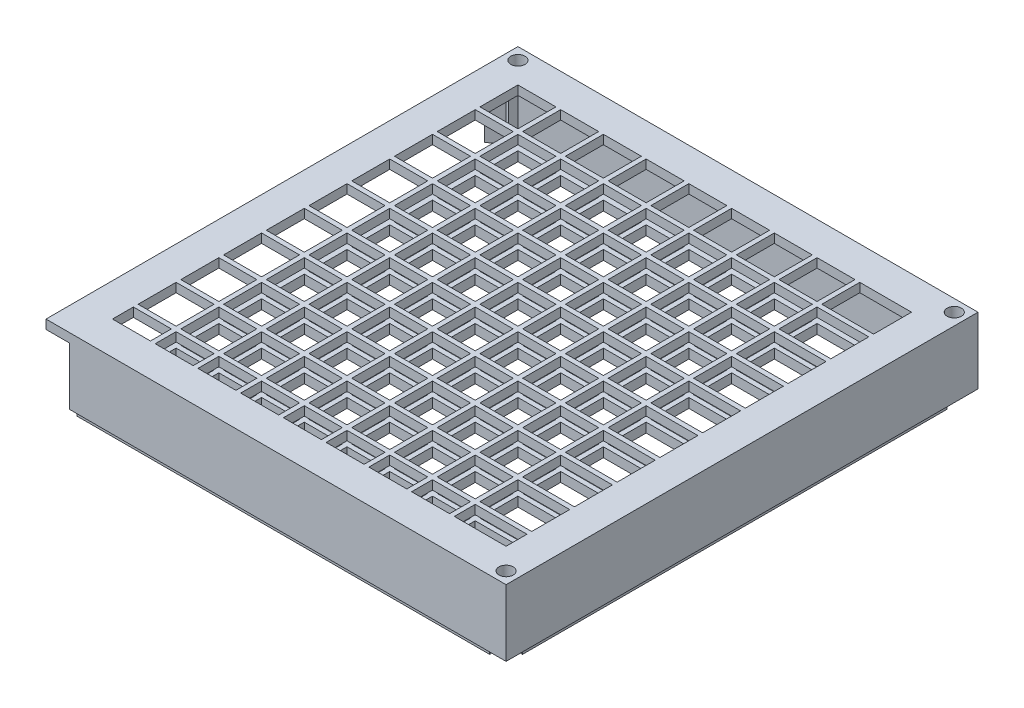
from build123d import *
from build123d.topology import SkipClean

# Parameters (mm, degrees)
EXTRUDE_1_DEPTH          = 2
EXTRUDE_2_OUTLINE_W      = 96.9
EXTRUDE_2_OUTLINE_H      = 99.4
EXTRUDE_2_OUTLINE_W_2    = 86.9
EXTRUDE_2_OUTLINE_H_2    = 89.4
EXTRUDE_2_DEPTH          = 14
CUT_EXTRUDE_1_DEPTH      = 140.334023124
CUT_EXTRUDE_1_DEPTH_BACK = 2
SKETCH_3_W               = 8
SKETCH_3_H               = 8
SKETCH_3_W_2             = 10.9
CUT_EXTRUDE_2_DEPTH      = 140.334023124
CUT_EXTRUDE_2_DEPTH_BACK = 2
SKETCH_3_5_W             = 8
SKETCH_3_5_H             = 8
SKETCH_3_5_W_2           = 10.9
CUT_EXTRUDE_3_DEPTH      = 140.334023124
CUT_EXTRUDE_3_DEPTH_BACK = 2
SKETCH_3_6_W             = 8
SKETCH_3_6_H             = 8
SKETCH_3_6_W_2           = 10.9
SKETCH_3_6_H_2           = 13.4
SKETCH_7_W               = 86.9
SKETCH_7_H               = 1.9
SKETCH_7_W_2             = 1.9
SKETCH_7_H_2             = 89.4
EXTRUDE_4_DEPTH          = 2
SKETCH_2_9_W             = 1
SKETCH_2_9_H             = 1
CUT_EXTRUDE_4_DEPTH      = 14
CUT_EXTRUDE_5_DEPTH      = 140.735357015
CUT_EXTRUDE_5_DEPTH_BACK = 14
SKETCH_9_W               = 86.9
SKETCH_9_H               = 89.4
EXTRUDE_6_DEPTH          = 1.9
SKETCH_10_W              = 8
SKETCH_10_H              = 8
SKETCH_10_W_2            = 10.9
CUT_EXTRUDE_6_DEPTH      = 1.9
CUT_EXTRUDE_7_DEPTH      = 140.735357015
CUT_EXTRUDE_7_DEPTH_BACK = 1.9
SKETCH_10_3_W            = 8
SKETCH_10_3_H            = 8
SKETCH_10_3_W_2          = 10.9
SKETCH_10_4_W            = 8
SKETCH_10_4_H            = 8
SKETCH_10_4_W_2          = 10.9
CUT_EXTRUDE_8_DEPTH      = 1.9
CUT_EXTRUDE_9_DEPTH      = 140.735357015
CUT_EXTRUDE_9_DEPTH_BACK = 1.9
SKETCH_10_5_W            = 8
SKETCH_10_5_H            = 8
SKETCH_10_5_W_2          = 10.9
SKETCH_10_5_H_2          = 4.4
SKETCH_12_W              = 5
SKETCH_12_H              = 92.4
EXTRUDE_7_DEPTH          = 1.9


with BuildPart() as part:
    # 草图2 → 凸台-拉伸1 (new body)
    with BuildSketch(Plane(origin=(0, 0, 0), x_dir=(1, 0, 0), z_dir=(0, 1, 0))):
        Polygon((5, -96.9), (5, -99.4), (96.9, -99.4), (96.9, 0), (0, 0), (0, -99.4), (2.5, -99.4), (2.5, -96.9), align=None)
    extrude(amount=EXTRUDE_1_DEPTH)


with BuildPart() as body_2:
    # 凸台-拉伸2: read off the stored shape, not the designer's step
    # 凸台-拉伸2 outline → 凸台-拉伸2 (new body)
    with BuildSketch(Plane(origin=(0, 0, 0), x_dir=(1, 0, 0), z_dir=(0, 1, 0))):
        with Locations((48.45, -49.7)):
            Rectangle(EXTRUDE_2_OUTLINE_W, EXTRUDE_2_OUTLINE_H)
        with BuildLine():
            Line((95.4, -98.018033989), (95.4, -97.9))
            Line((95.4, -97.9), (95.518033989, -97.9))
            ThreePointArc((95.518033989, -97.9), (95.460660172, -97.960660172), (95.4, -98.018033989))
        make_face(mode=Mode.SUBTRACT)
        with Locations((48.45, -49.7)):
            Rectangle(EXTRUDE_2_OUTLINE_W_2, EXTRUDE_2_OUTLINE_H_2, mode=Mode.SUBTRACT)
    extrude(amount=EXTRUDE_2_DEPTH)

    # Combine 1: union part
    add(part.part)

    # 草图3 → 切除-拉伸1 (cut, two sides: drawn at the far end of the back side and taken through both)
    with BuildSketch(Plane(origin=(0, 2, 0), x_dir=(1, 0, 0), z_dir=(0, 1, 0)).offset(-CUT_EXTRUDE_1_DEPTH_BACK)):
        Polygon((15, -10.9871117), (15, -7), (7, -7), (7, -10.9871117), (7, -15), (15, -15), align=None)
        with Locations((20, -11)):
            Rectangle(SKETCH_3_W, SKETCH_3_H)
        with Locations((29, -11)):
            Rectangle(SKETCH_3_W, SKETCH_3_H)
        with Locations((38, -11)):
            Rectangle(SKETCH_3_W, SKETCH_3_H)
        with Locations((47, -11)):
            Rectangle(SKETCH_3_W, SKETCH_3_H)
        with Locations((56, -11)):
            Rectangle(SKETCH_3_W, SKETCH_3_H)
        with Locations((65, -11)):
            Rectangle(SKETCH_3_W, SKETCH_3_H)
        with Locations((74, -11)):
            Rectangle(SKETCH_3_W, SKETCH_3_H)
        Polygon((87.509903413, -7), (79, -7), (79, -15), (87.509903413, -15), (89.9, -15), (89.9, -7), align=None)
        with Locations((84.45, -20)):
            Rectangle(SKETCH_3_W_2, SKETCH_3_H)
        with Locations((74, -20)):
            Rectangle(SKETCH_3_W, SKETCH_3_H)
        with Locations((65, -20)):
            Rectangle(SKETCH_3_W, SKETCH_3_H)
        with Locations((56, -20)):
            Rectangle(SKETCH_3_W, SKETCH_3_H)
        with Locations((47, -20)):
            Rectangle(SKETCH_3_W, SKETCH_3_H)
        with Locations((38, -20)):
            Rectangle(SKETCH_3_W, SKETCH_3_H)
        with Locations((29, -20)):
            Rectangle(SKETCH_3_W, SKETCH_3_H)
        with Locations((20, -20)):
            Rectangle(SKETCH_3_W, SKETCH_3_H)
        with Locations((11, -20)):
            Rectangle(SKETCH_3_W, SKETCH_3_H)
        with Locations((11, -29)):
            Rectangle(SKETCH_3_W, SKETCH_3_H)
        with Locations((20, -29)):
            Rectangle(SKETCH_3_W, SKETCH_3_H)
        with Locations((29, -29)):
            Rectangle(SKETCH_3_W, SKETCH_3_H)
        with Locations((38, -29)):
            Rectangle(SKETCH_3_W, SKETCH_3_H)
        with Locations((47, -29)):
            Rectangle(SKETCH_3_W, SKETCH_3_H)
        with Locations((56, -29)):
            Rectangle(SKETCH_3_W, SKETCH_3_H)
        with Locations((65, -29)):
            Rectangle(SKETCH_3_W, SKETCH_3_H)
        with Locations((74, -29)):
            Rectangle(SKETCH_3_W, SKETCH_3_H)
        with Locations((84.45, -29)):
            Rectangle(SKETCH_3_W_2, SKETCH_3_H)
    extrude(amount=CUT_EXTRUDE_1_DEPTH + CUT_EXTRUDE_1_DEPTH_BACK, mode=Mode.SUBTRACT)

    # 草图3<5> → 切除-拉伸2 (cut, two sides: drawn at the far end of the back side and taken through both)
    with BuildSketch(Plane(origin=(0, 2, 0), x_dir=(1, 0, 0), z_dir=(0, 1, 0)).offset(-CUT_EXTRUDE_2_DEPTH_BACK)):
        with Locations((11, -38)):
            Rectangle(SKETCH_3_5_W, SKETCH_3_5_H)
        with Locations((20, -38)):
            Rectangle(SKETCH_3_5_W, SKETCH_3_5_H)
        with Locations((29, -38)):
            Rectangle(SKETCH_3_5_W, SKETCH_3_5_H)
        with Locations((38, -38)):
            Rectangle(SKETCH_3_5_W, SKETCH_3_5_H)
        with Locations((47, -38)):
            Rectangle(SKETCH_3_5_W, SKETCH_3_5_H)
        with Locations((56, -38)):
            Rectangle(SKETCH_3_5_W, SKETCH_3_5_H)
        with Locations((65, -38)):
            Rectangle(SKETCH_3_5_W, SKETCH_3_5_H)
        with Locations((74, -38)):
            Rectangle(SKETCH_3_5_W, SKETCH_3_5_H)
        with Locations((84.45, -38)):
            Rectangle(SKETCH_3_5_W_2, SKETCH_3_5_H)
        with Locations((84.45, -47)):
            Rectangle(SKETCH_3_5_W_2, SKETCH_3_5_H)
        with Locations((74, -47)):
            Rectangle(SKETCH_3_5_W, SKETCH_3_5_H)
        with Locations((65, -47)):
            Rectangle(SKETCH_3_5_W, SKETCH_3_5_H)
        with Locations((56, -47)):
            Rectangle(SKETCH_3_5_W, SKETCH_3_5_H)
        with Locations((47, -47)):
            Rectangle(SKETCH_3_5_W, SKETCH_3_5_H)
        with Locations((38, -47)):
            Rectangle(SKETCH_3_5_W, SKETCH_3_5_H)
        with Locations((29, -47)):
            Rectangle(SKETCH_3_5_W, SKETCH_3_5_H)
        with Locations((20, -47)):
            Rectangle(SKETCH_3_5_W, SKETCH_3_5_H)
        with Locations((11, -47)):
            Rectangle(SKETCH_3_5_W, SKETCH_3_5_H)
        with Locations((11, -56)):
            Rectangle(SKETCH_3_5_W, SKETCH_3_5_H)
        with Locations((20, -56)):
            Rectangle(SKETCH_3_5_W, SKETCH_3_5_H)
        with Locations((29, -56)):
            Rectangle(SKETCH_3_5_W, SKETCH_3_5_H)
        with Locations((38, -56)):
            Rectangle(SKETCH_3_5_W, SKETCH_3_5_H)
        with Locations((47, -56)):
            Rectangle(SKETCH_3_5_W, SKETCH_3_5_H)
        with Locations((56, -56)):
            Rectangle(SKETCH_3_5_W, SKETCH_3_5_H)
        with Locations((65, -56)):
            Rectangle(SKETCH_3_5_W, SKETCH_3_5_H)
        with Locations((74, -56)):
            Rectangle(SKETCH_3_5_W, SKETCH_3_5_H)
        with Locations((84.45, -56)):
            Rectangle(SKETCH_3_5_W_2, SKETCH_3_5_H)
    extrude(amount=CUT_EXTRUDE_2_DEPTH + CUT_EXTRUDE_2_DEPTH_BACK, mode=Mode.SUBTRACT)

    # 草图3<6> → 切除-拉伸3 (cut, two sides: drawn at the far end of the back side and taken through both)
    with BuildSketch(Plane(origin=(0, 2, 0), x_dir=(1, 0, 0), z_dir=(0, 1, 0)).offset(-CUT_EXTRUDE_3_DEPTH_BACK)):
        with Locations((11, -65)):
            Rectangle(SKETCH_3_6_W, SKETCH_3_6_H)
        with Locations((20, -65)):
            Rectangle(SKETCH_3_6_W, SKETCH_3_6_H)
        with Locations((29, -65)):
            Rectangle(SKETCH_3_6_W, SKETCH_3_6_H)
        with Locations((38, -65)):
            Rectangle(SKETCH_3_6_W, SKETCH_3_6_H)
        with Locations((47, -65)):
            Rectangle(SKETCH_3_6_W, SKETCH_3_6_H)
        with Locations((56, -65)):
            Rectangle(SKETCH_3_6_W, SKETCH_3_6_H)
        with Locations((65, -65)):
            Rectangle(SKETCH_3_6_W, SKETCH_3_6_H)
        with Locations((74, -65)):
            Rectangle(SKETCH_3_6_W, SKETCH_3_6_H)
        with Locations((84.45, -65)):
            Rectangle(SKETCH_3_6_W_2, SKETCH_3_6_H)
        with Locations((84.45, -74)):
            Rectangle(SKETCH_3_6_W_2, SKETCH_3_6_H)
        with Locations((84.45, -85.7)):
            Rectangle(SKETCH_3_6_W_2, SKETCH_3_6_H_2)
        with Locations((74, -85.7)):
            Rectangle(SKETCH_3_6_W, SKETCH_3_6_H_2)
        with Locations((74, -74)):
            Rectangle(SKETCH_3_6_W, SKETCH_3_6_H)
        with Locations((65, -74)):
            Rectangle(SKETCH_3_6_W, SKETCH_3_6_H)
        with Locations((65, -85.7)):
            Rectangle(SKETCH_3_6_W, SKETCH_3_6_H_2)
        with Locations((56, -85.7)):
            Rectangle(SKETCH_3_6_W, SKETCH_3_6_H_2)
        with Locations((56, -74)):
            Rectangle(SKETCH_3_6_W, SKETCH_3_6_H)
        with Locations((47, -74)):
            Rectangle(SKETCH_3_6_W, SKETCH_3_6_H)
        with Locations((47, -85.7)):
            Rectangle(SKETCH_3_6_W, SKETCH_3_6_H_2)
        with Locations((38, -85.7)):
            Rectangle(SKETCH_3_6_W, SKETCH_3_6_H_2)
        with Locations((38, -74)):
            Rectangle(SKETCH_3_6_W, SKETCH_3_6_H)
        with Locations((29, -74)):
            Rectangle(SKETCH_3_6_W, SKETCH_3_6_H)
        with Locations((29, -85.7)):
            Rectangle(SKETCH_3_6_W, SKETCH_3_6_H_2)
        with Locations((20, -85.7)):
            Rectangle(SKETCH_3_6_W, SKETCH_3_6_H_2)
        with Locations((20, -74)):
            Rectangle(SKETCH_3_6_W, SKETCH_3_6_H)
        with Locations((11, -74)):
            Rectangle(SKETCH_3_6_W, SKETCH_3_6_H)
        with Locations((11, -85.7)):
            Rectangle(SKETCH_3_6_W, SKETCH_3_6_H_2)
    extrude(amount=CUT_EXTRUDE_3_DEPTH + CUT_EXTRUDE_3_DEPTH_BACK, mode=Mode.SUBTRACT)

    # 草图7 → 凸台-拉伸4 (add)
    with BuildSketch(Plane.XZ):
        with Locations((48.45, 96.9)):
            Rectangle(SKETCH_7_W, SKETCH_7_H)
        with Locations((94.4, 49.7)):
            Rectangle(SKETCH_7_W_2, SKETCH_7_H_2)
        with Locations((48.45, 2.5)):
            Rectangle(SKETCH_7_W, SKETCH_7_H)
    extrude(amount=EXTRUDE_4_DEPTH)

    # 草图2<9> → 切除-拉伸4 (cut)
    with SkipClean():  # the faces are left unmerged after this step: merging them gives an invalid solid
        with BuildSketch(Plane(origin=(0, 0, 0), x_dir=(1, 0, 0), z_dir=(0, 1, 0))):
            with BuildLine():
                Line((2.5, -2.5), (4, -2.5))
                ThreePointArc((4, -2.5), (3.901258538, -1.964766865), (3.618033989, -1.5))
                Line((3.618033989, -1.5), (1.5, -1.5))
                Line((1.5, -1.5), (1.5, -3.618033989))
                ThreePointArc((1.5, -3.618033989), (1.964766865, -3.901258538), (2.5, -4))
                Line((2.5, -4), (2.5, -2.5))
            make_face()
            with BuildLine():
                Line((1.5, -1.5), (3.618033989, -1.5))
                ThreePointArc((3.618033989, -1.5), (2.583462634, -1.002323804), (1.5, -1.381966011))
                Line((1.5, -1.381966011), (1.5, -1.5))
            make_face()
            with BuildLine():
                ThreePointArc((1.381966011, -1.5), (1.002323804, -2.583462634), (1.5, -3.618033989))
                Line((1.5, -3.618033989), (1.5, -1.5))
                Line((1.5, -1.5), (1.381966011, -1.5))
            make_face()
            with BuildLine():
                Line((1.381966011, -1.5), (1.5, -1.5))
                Line((1.5, -1.5), (1.5, -1.381966011))
                ThreePointArc((1.5, -1.381966011), (1.439339828, -1.439339828), (1.381966011, -1.5))
            make_face()
            with BuildLine():
                Line((3.5, -3.5), (3.618033989, -3.5))
                ThreePointArc((3.618033989, -3.5), (3.901258538, -3.035233135), (4, -2.5))
                Line((4, -2.5), (2.5, -2.5))
                Line((2.5, -2.5), (2.5, -4))
                ThreePointArc((2.5, -4), (3.035233135, -3.901258538), (3.5, -3.618033989))
                Line((3.5, -3.618033989), (3.5, -3.5))
            make_face()
            with BuildLine():
                ThreePointArc((3.5, -3.618033989), (3.560660172, -3.560660172), (3.618033989, -3.5))
                Line((3.618033989, -3.5), (3.5, -3.5))
                Line((3.5, -3.5), (3.5, -3.618033989))
            make_face()
            with BuildLine():
                ThreePointArc((93.4, -95.781966011), (93.339339828, -95.839339828), (93.281966011, -95.9))
                Line((93.281966011, -95.9), (93.4, -95.9))
                Line((93.4, -95.9), (93.4, -95.781966011))
            make_face()
            with BuildLine():
                Line((93.4, -95.9), (93.281966011, -95.9))
                ThreePointArc((93.281966011, -95.9), (92.998741462, -96.364766865), (92.9, -96.9))
                Line((92.9, -96.9), (94.4, -96.9))
                Line((94.4, -96.9), (94.4, -95.4))
                ThreePointArc((94.4, -95.4), (93.864766865, -95.498741462), (93.4, -95.781966011))
                Line((93.4, -95.781966011), (93.4, -95.9))
            make_face()
            with BuildLine():
                Line((94.4, -96.9), (92.9, -96.9))
                ThreePointArc((92.9, -96.9), (92.998741462, -97.435233135), (93.281966011, -97.9))
                Line((93.281966011, -97.9), (95.4, -97.9))
                Line((95.4, -97.9), (95.4, -95.781966011))
                ThreePointArc((95.4, -95.781966011), (94.935233135, -95.498741462), (94.4, -95.4))
                Line((94.4, -95.4), (94.4, -96.9))
            make_face()
            with BuildLine():
                Line((95.4, -97.9), (93.281966011, -97.9))
                ThreePointArc((93.281966011, -97.9), (94.316537366, -98.397676196), (95.4, -98.018033989))
                Line((95.4, -98.018033989), (95.4, -97.9))
            make_face()
            with BuildLine():
                ThreePointArc((95.9, -96.9), (95.769306394, -96.287627564), (95.4, -95.781966011))
                Line((95.4, -95.781966011), (95.4, -97.9))
                Line((95.4, -97.9), (95.518033989, -97.9))
                ThreePointArc((95.518033989, -97.9), (95.801258538, -97.435233135), (95.9, -96.9))
            make_face()
            with BuildLine():
                Line((95.518033989, -97.9), (95.4, -97.9))
                Line((95.4, -97.9), (95.4, -98.018033989))
                ThreePointArc((95.4, -98.018033989), (95.460660172, -97.960660172), (95.518033989, -97.9))
            make_face()
            with BuildLine():
                ThreePointArc((94.4, -1), (93.787627564, -1.130693606), (93.281966011, -1.5))
                Line((93.281966011, -1.5), (94.4, -1.5))
                Line((94.4, -1.5), (94.4, -1))
            make_face()
            with BuildLine():
                ThreePointArc((93.281966011, -1.5), (92.998741462, -1.964766865), (92.9, -2.5))
                Line((92.9, -2.5), (94.4, -2.5))
                Line((94.4, -2.5), (94.4, -1.5))
                Line((94.4, -1.5), (93.281966011, -1.5))
            make_face()
            with BuildLine():
                ThreePointArc((92.9, -2.5), (92.998741462, -3.035233135), (93.281966011, -3.5))
                Line((93.281966011, -3.5), (93.4, -3.5))
                Line((93.4, -3.5), (93.4, -3.618033989))
                ThreePointArc((93.4, -3.618033989), (93.864766865, -3.901258538), (94.4, -4))
                Line((94.4, -4), (94.4, -2.5))
                Line((94.4, -2.5), (92.9, -2.5))
            make_face()
            with BuildLine():
                Line((94.4, -2.5), (94.4, -4))
                ThreePointArc((94.4, -4), (94.935233135, -3.901258538), (95.4, -3.618033989))
                Line((95.4, -3.618033989), (95.4, -2.5))
                Line((95.4, -2.5), (94.4, -2.5))
            make_face()
            with Locations((94.9, -2)):
                Rectangle(SKETCH_2_9_W, SKETCH_2_9_H)
            with BuildLine():
                Line((95.4, -1.5), (95.4, -2.5))
                Line((95.4, -2.5), (95.9, -2.5))
                ThreePointArc((95.9, -2.5), (95.460660172, -1.439339828), (94.4, -1))
                Line((94.4, -1), (94.4, -1.5))
                Line((94.4, -1.5), (95.4, -1.5))
            make_face()
            with BuildLine():
                Line((95.4, -2.5), (95.4, -3.618033989))
                ThreePointArc((95.4, -3.618033989), (95.769306394, -3.112372436), (95.9, -2.5))
                Line((95.9, -2.5), (95.4, -2.5))
            make_face()
            with BuildLine():
                Line((93.4, -3.5), (93.281966011, -3.5))
                ThreePointArc((93.281966011, -3.5), (93.339339828, -3.560660172), (93.4, -3.618033989))
                Line((93.4, -3.618033989), (93.4, -3.5))
            make_face()
        extrude(amount=CUT_EXTRUDE_4_DEPTH, mode=Mode.SUBTRACT)

    # 草图8 → 切除-拉伸5 (cut, two sides: drawn at the far end of the back side and taken through both)
    with SkipClean():  # the faces are left unmerged after this step: merging them gives an invalid solid
        with BuildSketch(Plane(origin=(0, 14, 0), x_dir=(1, 0, 0), z_dir=(0, 1, 0)).offset(-CUT_EXTRUDE_5_DEPTH_BACK)):
            Polygon((2.5, -5), (5, -7), (0, -7), align=None)
            Polygon((5, -94.4), (5, -7), (0, -7), (0, -99.4), (5, -99.4), align=None)
        extrude(amount=CUT_EXTRUDE_5_DEPTH + CUT_EXTRUDE_5_DEPTH_BACK, mode=Mode.SUBTRACT)

    # 草图9 → 凸台-拉伸6 (add)
    with SkipClean():  # the faces are left unmerged after this step: merging them gives an invalid solid
        with BuildSketch(Plane(origin=(0, 14, 0), x_dir=(1, 0, 0), z_dir=(0, 1, 0))):
            with Locations((48.45, -49.7)):
                Rectangle(SKETCH_9_W, SKETCH_9_H)
        extrude(amount=-EXTRUDE_6_DEPTH)

    # 草图10 → 切除-拉伸6 (cut)
    with SkipClean():  # the faces are left unmerged after this step: merging them gives an invalid solid
        with BuildSketch(Plane(origin=(0, 14, 0), x_dir=(1, 0, 0), z_dir=(0, 1, 0))):
            Polygon((15, -9.386726528), (15, -7), (7, -7), (7, -9.386726528), (7, -15), (15, -15), align=None)
            with Locations((20, -11)):
                Rectangle(SKETCH_10_W, SKETCH_10_H)
            with Locations((29, -11)):
                Rectangle(SKETCH_10_W, SKETCH_10_H)
            with Locations((38, -11)):
                Rectangle(SKETCH_10_W, SKETCH_10_H)
            with Locations((47, -11)):
                Rectangle(SKETCH_10_W, SKETCH_10_H)
            with Locations((56, -11)):
                Rectangle(SKETCH_10_W, SKETCH_10_H)
            with Locations((65, -11)):
                Rectangle(SKETCH_10_W, SKETCH_10_H)
            with Locations((74, -11)):
                Rectangle(SKETCH_10_W, SKETCH_10_H)
            Polygon((88.320317488, -7), (79, -7), (79, -15), (88.320317488, -15), (89.9, -15), (89.9, -7), align=None)
            with Locations((84.45, -20)):
                Rectangle(SKETCH_10_W_2, SKETCH_10_H)
            with Locations((74, -20)):
                Rectangle(SKETCH_10_W, SKETCH_10_H)
            with Locations((65, -20)):
                Rectangle(SKETCH_10_W, SKETCH_10_H)
            with Locations((56, -20)):
                Rectangle(SKETCH_10_W, SKETCH_10_H)
            with Locations((47, -20)):
                Rectangle(SKETCH_10_W, SKETCH_10_H)
            with Locations((38, -20)):
                Rectangle(SKETCH_10_W, SKETCH_10_H)
            with Locations((29, -20)):
                Rectangle(SKETCH_10_W, SKETCH_10_H)
            with Locations((20, -20)):
                Rectangle(SKETCH_10_W, SKETCH_10_H)
            with Locations((11, -20)):
                Rectangle(SKETCH_10_W, SKETCH_10_H)
            with Locations((11, -29)):
                Rectangle(SKETCH_10_W, SKETCH_10_H)
            with Locations((20, -29)):
                Rectangle(SKETCH_10_W, SKETCH_10_H)
            with Locations((29, -29)):
                Rectangle(SKETCH_10_W, SKETCH_10_H)
            with Locations((38, -29)):
                Rectangle(SKETCH_10_W, SKETCH_10_H)
            with Locations((47, -29)):
                Rectangle(SKETCH_10_W, SKETCH_10_H)
            with Locations((56, -29)):
                Rectangle(SKETCH_10_W, SKETCH_10_H)
            with Locations((65, -29)):
                Rectangle(SKETCH_10_W, SKETCH_10_H)
            with Locations((74, -29)):
                Rectangle(SKETCH_10_W, SKETCH_10_H)
            with Locations((84.45, -29)):
                Rectangle(SKETCH_10_W_2, SKETCH_10_H)
        extrude(amount=-CUT_EXTRUDE_6_DEPTH, mode=Mode.SUBTRACT)

    # 草图10<3> → 切除-拉伸7 (cut, two sides: drawn at the far end of the back side and taken through both)
    with SkipClean():  # the faces are left unmerged after this step: merging them gives an invalid solid
        with BuildSketch(Plane(origin=(0, 14, 0), x_dir=(1, 0, 0), z_dir=(0, 1, 0)).offset(-CUT_EXTRUDE_7_DEPTH_BACK)):
            with Locations((11, -38)):
                Rectangle(SKETCH_10_3_W, SKETCH_10_3_H)
            with Locations((20, -38)):
                Rectangle(SKETCH_10_3_W, SKETCH_10_3_H)
            with Locations((29, -38)):
                Rectangle(SKETCH_10_3_W, SKETCH_10_3_H)
            with Locations((38, -38)):
                Rectangle(SKETCH_10_3_W, SKETCH_10_3_H)
            with Locations((47, -38)):
                Rectangle(SKETCH_10_3_W, SKETCH_10_3_H)
            with Locations((56, -38)):
                Rectangle(SKETCH_10_3_W, SKETCH_10_3_H)
            with Locations((65, -38)):
                Rectangle(SKETCH_10_3_W, SKETCH_10_3_H)
            with Locations((74, -38)):
                Rectangle(SKETCH_10_3_W, SKETCH_10_3_H)
            with Locations((84.45, -38)):
                Rectangle(SKETCH_10_3_W_2, SKETCH_10_3_H)
            with Locations((84.45, -47)):
                Rectangle(SKETCH_10_3_W_2, SKETCH_10_3_H)
            with Locations((74, -47)):
                Rectangle(SKETCH_10_3_W, SKETCH_10_3_H)
            with Locations((65, -47)):
                Rectangle(SKETCH_10_3_W, SKETCH_10_3_H)
            with Locations((56, -47)):
                Rectangle(SKETCH_10_3_W, SKETCH_10_3_H)
            with Locations((47, -47)):
                Rectangle(SKETCH_10_3_W, SKETCH_10_3_H)
            with Locations((38, -47)):
                Rectangle(SKETCH_10_3_W, SKETCH_10_3_H)
            with Locations((29, -47)):
                Rectangle(SKETCH_10_3_W, SKETCH_10_3_H)
            with Locations((20, -47)):
                Rectangle(SKETCH_10_3_W, SKETCH_10_3_H)
            with Locations((11, -47)):
                Rectangle(SKETCH_10_3_W, SKETCH_10_3_H)
            with Locations((11, -56)):
                Rectangle(SKETCH_10_3_W, SKETCH_10_3_H)
            with Locations((20, -56)):
                Rectangle(SKETCH_10_3_W, SKETCH_10_3_H)
            with Locations((29, -56)):
                Rectangle(SKETCH_10_3_W, SKETCH_10_3_H)
            with Locations((38, -56)):
                Rectangle(SKETCH_10_3_W, SKETCH_10_3_H)
            with Locations((47, -56)):
                Rectangle(SKETCH_10_3_W, SKETCH_10_3_H)
            with Locations((56, -56)):
                Rectangle(SKETCH_10_3_W, SKETCH_10_3_H)
            with Locations((65, -56)):
                Rectangle(SKETCH_10_3_W, SKETCH_10_3_H)
            with Locations((74, -56)):
                Rectangle(SKETCH_10_3_W, SKETCH_10_3_H)
            with Locations((84.45, -56)):
                Rectangle(SKETCH_10_3_W_2, SKETCH_10_3_H)
        extrude(amount=CUT_EXTRUDE_7_DEPTH + CUT_EXTRUDE_7_DEPTH_BACK, mode=Mode.SUBTRACT)

    # 草图10<4> → 切除-拉伸8 (cut)
    with SkipClean():  # the faces are left unmerged after this step: merging them gives an invalid solid
        with BuildSketch(Plane(origin=(0, 14, 0), x_dir=(1, 0, 0), z_dir=(0, 1, 0))):
            with Locations((11, -65)):
                Rectangle(SKETCH_10_4_W, SKETCH_10_4_H)
            with Locations((20, -65)):
                Rectangle(SKETCH_10_4_W, SKETCH_10_4_H)
            with Locations((29, -65)):
                Rectangle(SKETCH_10_4_W, SKETCH_10_4_H)
            with Locations((38, -65)):
                Rectangle(SKETCH_10_4_W, SKETCH_10_4_H)
            with Locations((47, -65)):
                Rectangle(SKETCH_10_4_W, SKETCH_10_4_H)
            with Locations((56, -65)):
                Rectangle(SKETCH_10_4_W, SKETCH_10_4_H)
            with Locations((65, -65)):
                Rectangle(SKETCH_10_4_W, SKETCH_10_4_H)
            with Locations((74, -65)):
                Rectangle(SKETCH_10_4_W, SKETCH_10_4_H)
            with Locations((84.45, -65)):
                Rectangle(SKETCH_10_4_W_2, SKETCH_10_4_H)
            with Locations((84.45, -74)):
                Rectangle(SKETCH_10_4_W_2, SKETCH_10_4_H)
            with Locations((74, -74)):
                Rectangle(SKETCH_10_4_W, SKETCH_10_4_H)
            with Locations((65, -74)):
                Rectangle(SKETCH_10_4_W, SKETCH_10_4_H)
            with Locations((56, -74)):
                Rectangle(SKETCH_10_4_W, SKETCH_10_4_H)
            with Locations((47, -74)):
                Rectangle(SKETCH_10_4_W, SKETCH_10_4_H)
            with Locations((38, -74)):
                Rectangle(SKETCH_10_4_W, SKETCH_10_4_H)
            with Locations((29, -74)):
                Rectangle(SKETCH_10_4_W, SKETCH_10_4_H)
            with Locations((20, -74)):
                Rectangle(SKETCH_10_4_W, SKETCH_10_4_H)
            with Locations((11, -74)):
                Rectangle(SKETCH_10_4_W, SKETCH_10_4_H)
        extrude(amount=-CUT_EXTRUDE_8_DEPTH, mode=Mode.SUBTRACT)

    # 草图10<5> → 切除-拉伸9 (cut, two sides: drawn at the far end of the back side and taken through both)
    with SkipClean():  # the faces are left unmerged after this step: merging them gives an invalid solid
        with BuildSketch(Plane(origin=(0, 14, 0), x_dir=(1, 0, 0), z_dir=(0, 1, 0)).offset(-CUT_EXTRUDE_9_DEPTH_BACK)):
            with Locations((11, -83)):
                Rectangle(SKETCH_10_5_W, SKETCH_10_5_H)
            with Locations((20, -83)):
                Rectangle(SKETCH_10_5_W, SKETCH_10_5_H)
            with Locations((29, -83)):
                Rectangle(SKETCH_10_5_W, SKETCH_10_5_H)
            with Locations((38, -83)):
                Rectangle(SKETCH_10_5_W, SKETCH_10_5_H)
            with Locations((47, -83)):
                Rectangle(SKETCH_10_5_W, SKETCH_10_5_H)
            with Locations((56, -83)):
                Rectangle(SKETCH_10_5_W, SKETCH_10_5_H)
            with Locations((65, -83)):
                Rectangle(SKETCH_10_5_W, SKETCH_10_5_H)
            with Locations((74, -83)):
                Rectangle(SKETCH_10_5_W, SKETCH_10_5_H)
            with Locations((84.45, -83)):
                Rectangle(SKETCH_10_5_W_2, SKETCH_10_5_H)
            with Locations((84.45, -90.2)):
                Rectangle(SKETCH_10_5_W_2, SKETCH_10_5_H_2)
            with Locations((74, -90.2)):
                Rectangle(SKETCH_10_5_W, SKETCH_10_5_H_2)
            with Locations((65, -90.2)):
                Rectangle(SKETCH_10_5_W, SKETCH_10_5_H_2)
            with Locations((56, -90.2)):
                Rectangle(SKETCH_10_5_W, SKETCH_10_5_H_2)
            with Locations((47, -90.2)):
                Rectangle(SKETCH_10_5_W, SKETCH_10_5_H_2)
            with Locations((38, -90.2)):
                Rectangle(SKETCH_10_5_W, SKETCH_10_5_H_2)
            with Locations((29, -90.2)):
                Rectangle(SKETCH_10_5_W, SKETCH_10_5_H_2)
            with Locations((20, -90.2)):
                Rectangle(SKETCH_10_5_W, SKETCH_10_5_H_2)
            with Locations((11, -90.2)):
                Rectangle(SKETCH_10_5_W, SKETCH_10_5_H_2)
        extrude(amount=CUT_EXTRUDE_9_DEPTH + CUT_EXTRUDE_9_DEPTH_BACK, mode=Mode.SUBTRACT)

    # 草图12 → 凸台-拉伸7 (add)
    with SkipClean():  # the faces are left unmerged after this step: merging them gives an invalid solid
        with BuildSketch(Plane(origin=(0, 14, 0), x_dir=(1, 0, 0), z_dir=(0, 1, 0))):
            Polygon((0, -7), (5, -7), (2.5, -5), align=None)
            with Locations((2.5, -53.2)):
                Rectangle(SKETCH_12_W, SKETCH_12_H)
        extrude(amount=-EXTRUDE_7_DEPTH)


solid = body_2.part
